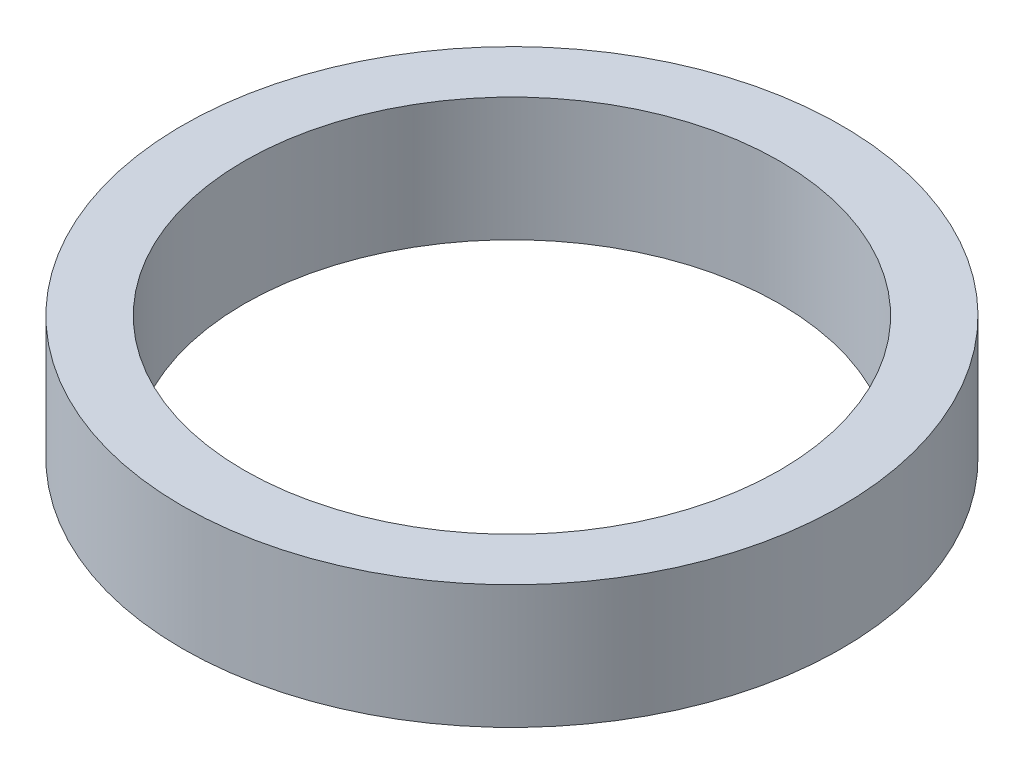
from build123d import *

# Parameters (mm, degrees)
SKETCH1_R           = 40
BOSS_EXTRUDE1_DEPTH = 15
SKETCH2_R           = 32.5
CUT_EXTRUDE1_DEPTH  = 59.523499554


with BuildPart() as part:
    # Sketch1 → Boss-Extrude1 (new body)
    with BuildSketch(Plane(origin=(0, 0, 0), x_dir=(1, 0, 0), z_dir=(0, 1, 0))):
        Circle(SKETCH1_R)
    extrude(amount=BOSS_EXTRUDE1_DEPTH)

    # Sketch2 → Cut-Extrude1 (cut, through all)
    with BuildSketch(Plane(origin=(0, 0, 0), x_dir=(1, 0, 0), z_dir=(0, 1, 0))):
        Circle(SKETCH2_R)
    extrude(amount=CUT_EXTRUDE1_DEPTH, mode=Mode.SUBTRACT)


solid = part.part
